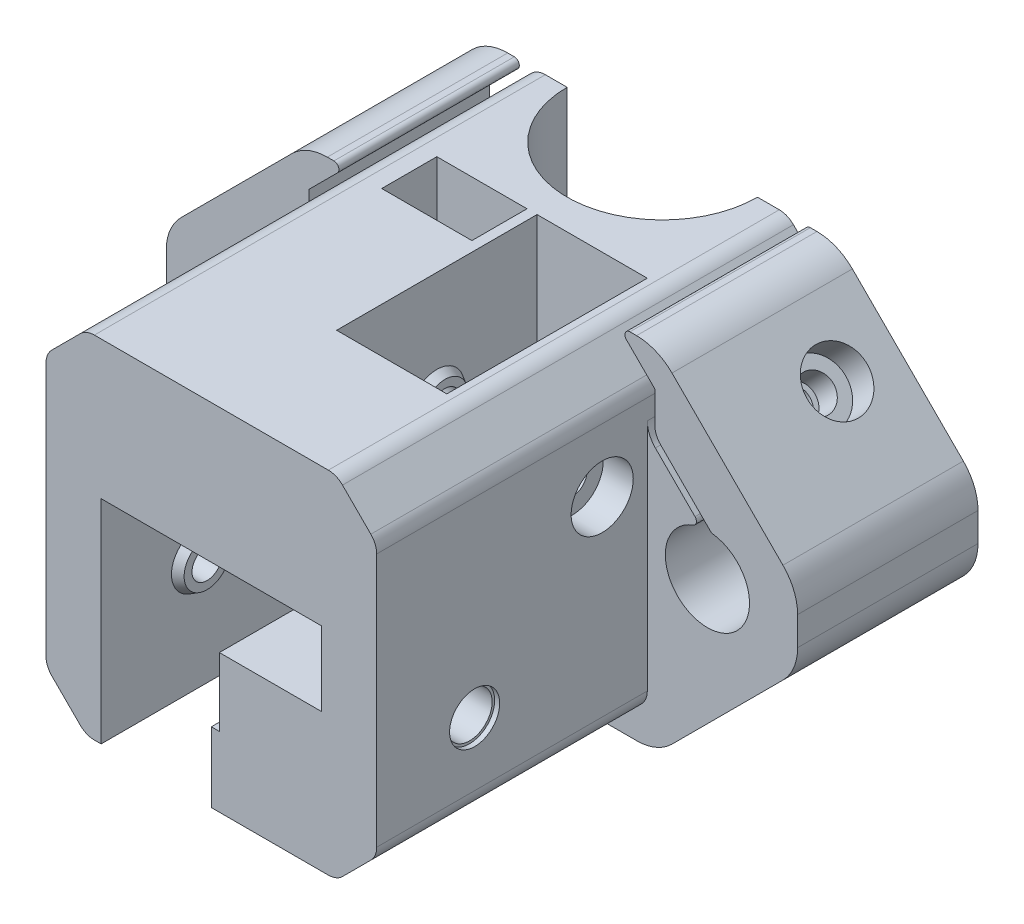
from build123d import *

# Parameters (mm, degrees)
BOSS_EXTRUDE1_DEPTH     = 18
SKETCH2_R               = 9.5
SKETCH2_W               = 9
SKETCH2_H               = 5.5
CUT_EXTRUDE1_DEPTH      = 51.410812332
FILLET1_R               = 5
FILLET2_R               = 0.5
FILLET3_R               = 2
FILLET4_R               = 2.75
CUT_EXTRUDE2_DEPTH      = 15
SKETCH7_R               = 1.6
CUT_EXTRUDE3_DEPTH      = 10
SKETCH8_R               = 2.35
CUT_EXTRUDE4_DEPTH      = 5
SKETCH9_R               = 2.5
CUT_EXTRUDE5_DEPTH      = 0.5
MIRROR3_COPY_1_SKETCH_R = 1.6
MIRROR3_COPY_1_DEPTH    = 10
MIRROR3_COPY_2_SKETCH_R = 2.35
MIRROR3_COPY_2_DEPTH    = 5
MIRROR3_COPY_3_SKETCH_R = 2.5
MIRROR3_COPY_3_DEPTH    = 0.5
BOSS_EXTRUDE2_DEPTH     = 27
SKETCH11_W              = 11
SKETCH11_H              = 20
CUT_EXTRUDE6_DEPTH      = 21.2
SKETCH12_W              = 11
SKETCH12_H              = 3.7
CUT_EXTRUDE7_DEPTH      = 12.5
FILLET5_R               = 10
CUT_EXTRUDE8_REACH      = 67.133
SKETCH13_W              = 11
SKETCH13_H              = 19.8
FILLET6_R               = 10
SKETCH14_W              = 11
SKETCH14_H              = 7.4
CUT_EXTRUDE9_DEPTH      = 12.5
SKETCH15_R              = 2.75
BOSS_EXTRUDE3_DEPTH     = 0.8
BOSS_EXTRUDE3_TAPER     = 30
SKETCH16_W              = 14
SKETCH16_H              = 6.815
CUT_EXTRUDE10_DEPTH     = 0.8
SKETCH19_R              = 2.75
BOSS_EXTRUDE4_DEPTH     = 0.8
BOSS_EXTRUDE4_TAPER     = 30
FILLET7_R               = 2


with BuildPart() as part:
    # Sketch1 → Boss-Extrude1 (new body)
    with BuildSketch(Plane.XY):
        with BuildLine():
            Line((-17.5, 17.5), (-31.5, 3.5))
            Line((-31.5, 3.5), (-31.5, -3.5))
            Line((-31.5, -3.5), (-17.5, -17.5))
            Line((-17.5, -17.5), (17.5, -17.5))
            Line((17.5, -17.5), (31.5, -3.5))
            Line((31.5, -3.5), (31.5, 3.5))
            Line((31.5, 3.5), (17.5, 17.5))
            Line((17.5, 17.5), (13.560660172, 17.5))
            Line((13.560660172, 17.5), (17.25, 13.810660172))
            Line((17.25, 13.810660172), (17.25, 9.845660172))
            Line((17.25, 9.845660172), (22.916347453, 4.179312718))
            ThreePointArc((22.916347453, 4.179312718), (22.602164744, -4.198757241), (21.880882362, 4.154117638))
            Line((21.880882362, 4.154117638), (16.5, 9.535))
            Line((16.5, 9.535), (16.5, 13.5))
            Line((16.5, 13.5), (12.5, 17.5))
            Line((12.5, 17.5), (-12.5, 17.5))
            Line((-12.5, 17.5), (-16.5, 13.5))
            Line((-16.5, 13.5), (-16.5, 9.535))
            Line((-16.5, 9.535), (-21.880882362, 4.154117638))
            ThreePointArc((-21.880882362, 4.154117638), (-22.602164744, -4.198757241), (-22.916347453, 4.179312718))
            Line((-22.916347453, 4.179312718), (-17.25, 9.845660172))
            Line((-17.25, 9.845660172), (-17.25, 13.810660172))
            Line((-17.25, 13.810660172), (-13.560660172, 17.5))
            Line((-13.560660172, 17.5), (-17.5, 17.5))
        make_face()
    extrude(amount=BOSS_EXTRUDE1_DEPTH)

    # Sketch2 → Cut-Extrude1 (cut, through all)
    with BuildSketch(Plane(origin=(0, 17.5, 0), x_dir=(1, 0, 0), z_dir=(0, 1, 0))):
        Circle(SKETCH2_R)
        with Locations((-5.5, -15.25)):
            Rectangle(SKETCH2_W, SKETCH2_H)
    extrude(amount=-CUT_EXTRUDE1_DEPTH, mode=Mode.SUBTRACT)

    # Fillet1
    fillet1_edges = [part.edges().sort_by_distance(p)[0] for p in [
        (17.5, 17.5, 9),
        (31.5, 3.5, 9),
        (31.5, -3.5, 9),
        (17.5, -17.5, 9),
        (-17.5, -17.5, 9),
        (-31.5, -3.5, 9),
        (-31.5, 3.5, 9),
        (-17.5, 17.5, 9),
    ]]
    fillet(fillet1_edges, radius=FILLET1_R)

    # Fillet2
    fillet2_edges = [part.edges().sort_by_distance(p)[0] for p in [
        (-13.560660172, 17.5, 9),
        (-22.916347453, 4.179312718, 9),
        (-21.880882362, 4.154117638, 9),
        (21.880882362, 4.154117638, 9),
        (22.916347453, 4.179312718, 9),
        (13.560660172, 17.5, 9),
    ]]
    fillet(fillet2_edges, radius=FILLET2_R)

    # Fillet3
    fillet3_edges = [part.edges().sort_by_distance(p)[0] for p in [
        (-17.25, 9.845660172, 9),
        (17.25, 9.845660172, 9),
    ]]
    fillet(fillet3_edges, radius=FILLET3_R)

    # Fillet4
    fillet4_edges = [part.edges().sort_by_distance(p)[0] for p in [
        (-16.5, 9.535, 9),
        (16.5, 9.535, 9),
    ]]
    fillet(fillet4_edges, radius=FILLET4_R)

    # Sketch4 → Cut-Revolve1 (revolve, cut)
    with BuildSketch(Plane(origin=(0, 0, 6), x_dir=(-1, 0, 0), z_dir=(0, 0, -1))):
        Polygon((23.439696962, 11.560303038), (25.561017306, 9.438982694), (23.439696962, 7.317662351), (22.555813485, 8.201545827), (14.070532111, -0.283735547), (12.833095244, 0.95370132), align=None)
    cut_revolve1 = revolve(axis=Axis((-23.439696962, 11.560303038, 6), (0.7071067811865471, -0.707106781186548, 0)), mode=Mode.SUBTRACT)

    # Sketch6 → Cut-Extrude2 (cut)
    with BuildSketch(Plane(origin=(-6.893398282, 6.893398282, 0), x_dir=(0, 0, 1), z_dir=(-0.7071067811865471, 0.707106781186548, 0))):
        Polygon((3.425, -9.886676943), (6, -11.373353886), (8.575, -9.886676943), (8.575, -6.913323057), (6, -5.426646114), (3.425, -6.913323057), align=None)
    cut_extrude2 = extrude(amount=-CUT_EXTRUDE2_DEPTH, mode=Mode.SUBTRACT)

    # Mirror1: Cut-Revolve1, Cut-Extrude2 across plane
    add(cut_revolve1.mirror(Plane(origin=(0, 0, 0), x_dir=(0, 0, 1), z_dir=(1, 0, 0))), mode=Mode.SUBTRACT)
    add(cut_extrude2.mirror(Plane(origin=(0, 0, 0), x_dir=(0, 0, 1), z_dir=(1, 0, 0))), mode=Mode.SUBTRACT)

    # Sketch7 → Cut-Extrude3 (cut)
    with BuildSketch(Plane(origin=(0, 0, 0), x_dir=(-1, 0, 0), z_dir=(0, 0, -1))):
        with Locations((-12.5, 12.5)):
            Circle(SKETCH7_R)
    cut_extrude3 = extrude(amount=-CUT_EXTRUDE3_DEPTH, mode=Mode.SUBTRACT)

    # Sketch8 → Cut-Extrude4 (cut)
    with BuildSketch(Plane(origin=(0, 0, 0), x_dir=(-1, 0, 0), z_dir=(0, 0, -1))):
        with Locations((-12.5, 12.5)):
            Circle(SKETCH8_R)
    cut_extrude4 = extrude(amount=-CUT_EXTRUDE4_DEPTH, mode=Mode.SUBTRACT)

    # Sketch9 → Cut-Extrude5 (cut)
    with BuildSketch(Plane(origin=(0, 0, 0), x_dir=(-1, 0, 0), z_dir=(0, 0, -1))):
        with Locations((-12.5, 12.5)):
            Circle(SKETCH9_R)
    cut_extrude5 = extrude(amount=-CUT_EXTRUDE5_DEPTH, mode=Mode.SUBTRACT)

    # Mirror2: Cut-Extrude3, Cut-Extrude4, Cut-Extrude5 across plane
    add(cut_extrude3.mirror(Plane.ZX), mode=Mode.SUBTRACT)
    add(cut_extrude4.mirror(Plane.ZX), mode=Mode.SUBTRACT)
    add(cut_extrude5.mirror(Plane.ZX), mode=Mode.SUBTRACT)

    # Mirror3: Cut-Extrude3, Cut-Extrude4, Cut-Extrude5 across plane
    add(cut_extrude3.mirror(Plane(origin=(0, 0, 0), x_dir=(0, 0, 1), z_dir=(1, 0, 0))), mode=Mode.SUBTRACT)
    add(cut_extrude4.mirror(Plane(origin=(0, 0, 0), x_dir=(0, 0, 1), z_dir=(1, 0, 0))), mode=Mode.SUBTRACT)
    add(cut_extrude5.mirror(Plane(origin=(0, 0, 0), x_dir=(0, 0, 1), z_dir=(1, 0, 0))), mode=Mode.SUBTRACT)

    # Mirror3 copy 1 sketch → Mirror3 copy 1 (cut)
    with BuildSketch(Plane(origin=(0, 0, 0), x_dir=(1, 0, 0), z_dir=(0, 0, -1))):
        with Locations((-12.5, 12.5)):
            Circle(MIRROR3_COPY_1_SKETCH_R)
    extrude(amount=-MIRROR3_COPY_1_DEPTH, mode=Mode.SUBTRACT)

    # Mirror3 copy 2 sketch → Mirror3 copy 2 (cut)
    with BuildSketch(Plane(origin=(0, 0, 0), x_dir=(1, 0, 0), z_dir=(0, 0, -1))):
        with Locations((-12.5, 12.5)):
            Circle(MIRROR3_COPY_2_SKETCH_R)
    extrude(amount=-MIRROR3_COPY_2_DEPTH, mode=Mode.SUBTRACT)

    # Mirror3 copy 3 sketch → Mirror3 copy 3 (cut)
    with BuildSketch(Plane(origin=(0, 0, 0), x_dir=(1, 0, 0), z_dir=(0, 0, -1))):
        with Locations((-12.5, 12.5)):
            Circle(MIRROR3_COPY_3_SKETCH_R)
    extrude(amount=-MIRROR3_COPY_3_DEPTH, mode=Mode.SUBTRACT)

    # Sketch10 → Boss-Extrude2 (add)
    with BuildSketch(Plane.XY.offset(18)):
        Polygon((12.5, 17.5), (-12.5, 17.5), (-16.5, 13.5), (-16.5, -13.5), (-12.5, -17.5), (12.5, -17.5), (16.5, -13.5), (16.5, 13.5), align=None)
    extrude(amount=BOSS_EXTRUDE2_DEPTH)

    # Sketch11 → Cut-Extrude6 (cut)
    with BuildSketch(Plane(origin=(0, 17.5, 0), x_dir=(1, 0, 0), z_dir=(0, 1, 0))):
        with Locations((5.5, -22.5)):
            Rectangle(SKETCH11_W, SKETCH11_H)
    extrude(amount=-CUT_EXTRUDE6_DEPTH, mode=Mode.SUBTRACT)

    # Sketch12 → Cut-Extrude7 (cut)
    with BuildSketch(Plane(origin=(0, 0, 32.5), x_dir=(-1, 0, 0), z_dir=(0, 0, -1))):
        with Locations((-5.5, 1.85)):
            Rectangle(SKETCH12_W, SKETCH12_H)
        Polygon((-11, -3.7), (0, -3.7), (0, -3.591245546), (0, 0), (-11, 0), align=None)
    extrude(amount=-CUT_EXTRUDE7_DEPTH, mode=Mode.SUBTRACT)

    # Fillet5
    fillet5_edges = [part.edges().sort_by_distance(p)[0] for p in [
        (5.5, -3.7, 12.5),
    ]]
    fillet(fillet5_edges, radius=FILLET5_R)

    # Cut-Extrude8: up to this face of the body (flat: up to its plane)
    cut_extrude8_end = Plane(part.part.faces().sort_by_distance((5.5, 3.7, 38.75))[0])
    # Sketch13 → Cut-Extrude8 (cut, up to the picked face)
    with BuildSketch(Plane.XZ.offset(17.5), mode=Mode.PRIVATE) as cut_extrude8_sk1:
        with Locations((-5.5, 35.1)):
            Rectangle(SKETCH13_W, SKETCH13_H)
    cut_extrude8_tool1 = split(extrude(cut_extrude8_sk1.sketch, amount=-CUT_EXTRUDE8_REACH, mode=Mode.PRIVATE), bisect_by=cut_extrude8_end, keep=Keep.BOTH, mode=Mode.PRIVATE)
    add(cut_extrude8_tool1.solids().sort_by(Axis((-5.5, -17.5, 35.1), (0, 1, 0)))[0], mode=Mode.SUBTRACT)

    # Fillet6
    # the kernel refuses this fillet: 10 mm, written as the material it adds along each edge
    with BuildSketch(Plane(origin=(25, 3.7, 25.2), x_dir=(0, 0, 1), z_dir=(-1, 0, 0))) as fillet6_piece_1_section:
        with BuildLine():
            CenterArc((FILLET6_R, -FILLET6_R), FILLET6_R, 90, 90)
            Line((0, -FILLET6_R), (0, 0))
            Line((0, 0), (FILLET6_R, 0))
        make_face()
    fillet6_piece_1 = extrude(amount=36, mode=Mode.PRIVATE)
    fillet6_piece_1 = split(fillet6_piece_1, bisect_by=Plane(origin=(5.5, 3.588944861, 32.5), z_dir=(0, 0, 1)), keep=Keep.TOP, mode=Mode.PRIVATE)
    fillet6_piece_1 = split(fillet6_piece_1, bisect_by=Plane(origin=(11, 3.588944861, 33.172467691), z_dir=(-1, 0, 0)), keep=Keep.TOP, mode=Mode.PRIVATE)
    add(fillet6_piece_1)
    with BuildSketch(Plane(origin=(0, 3.7, 25.2), x_dir=(0, 0, 1), z_dir=(-1, 0, 0))) as fillet6_piece_2:
        with BuildLine():
            CenterArc((FILLET6_R, -FILLET6_R), FILLET6_R, 90, 90)
            Line((0, -FILLET6_R), (0, 0))
            Line((0, 0), (FILLET6_R, 0))
        make_face()
    extrude(amount=11)

    # Sketch14 → Cut-Extrude9 (cut)
    with BuildSketch(Plane.XY.offset(45)):
        with Locations((5.5, 0)):
            Rectangle(SKETCH14_W, SKETCH14_H)
    extrude(amount=-CUT_EXTRUDE9_DEPTH, mode=Mode.SUBTRACT)

    # Sketch15 → Boss-Extrude3 (add)
    with BuildSketch(Plane(origin=(-11, 0, 0), x_dir=(0, 0, -1), z_dir=(1, 0, 0))):
        with Locations((-35.23, -6.365)):
            Circle(SKETCH15_R)
    extrude(amount=BOSS_EXTRUDE3_DEPTH, taper=BOSS_EXTRUDE3_TAPER)

    # Sketch16 → Cut-Extrude10 (cut)
    with BuildSketch(Plane.ZY):
        with Locations((38, -7.1075)):
            Rectangle(SKETCH16_W, SKETCH16_H)
    extrude(amount=-CUT_EXTRUDE10_DEPTH, mode=Mode.SUBTRACT)

    # Sketch17 → Cut-Revolve2 (revolve, cut)
    with BuildSketch(Plane.XY.offset(35.23)):
        Polygon((-16.5, -6.365), (-16.5, -3.265), (-13.5, -3.265), (-13.5, -4.865), (11.5, -4.865), (11.5, -4.115), (16, -4.115), (16, -3.865), (16.5, -3.865), (16.5, -6.365), align=None)
    revolve(axis=Axis((31.947720378, -6.365, 35.23), (-1, 0, 0)), mode=Mode.SUBTRACT)

    # Sketch19 → Boss-Extrude4 (add)
    with BuildSketch(Plane.ZY.offset(-11)):
        with Locations((22.5, 6.365)):
            Circle(SKETCH19_R)
    boss_extrude4 = extrude(amount=BOSS_EXTRUDE4_DEPTH, taper=BOSS_EXTRUDE4_TAPER)

    # Mirror4: Boss-Extrude4 across plane
    add(boss_extrude4.mirror(Plane(origin=(5.5, 0, 0), x_dir=(0, 0, 1), z_dir=(1, 0, 0))))

    # Sketch20 → Cut-Revolve3 (revolve, cut)
    with BuildSketch(Plane.XY.offset(22.5), mode=Mode.PRIVATE) as cut_revolve3_sk:
        Polygon((16.5, 6.365), (16.5, 9.465), (13.5, 9.465), (13.5, 7.865), (-11.5, 7.865), (-11.5, 8.615), (-16, 8.615), (-16, 8.865), (-16.5, 8.865), (-16.5, 6.365), align=None)
    revolve(cut_revolve3_sk.sketch.rotate(Axis((11, 6.365, 22.5), (-1, 0, 0)), 90), axis=Axis((11, 6.365, 22.5), (-1, 0, 0)), mode=Mode.SUBTRACT)

    # Fillet7
    fillet7_edges = [part.edges().sort_by_distance(p)[0] for p in [
        (16.5, -13.5, 31.5),
        (12.5, -17.5, 31.5),
        (-12.5, -17.5, 31.5),
        (-16.5, -13.5, 31.5),
        (-16.5, 13.5, 22.5),
        (-12.5, 17.5, 22.5),
        (12.5, 17.5, 22.5),
        (16.5, 13.5, 22.5),
    ]]
    fillet(fillet7_edges, radius=FILLET7_R)


solid = part.part
